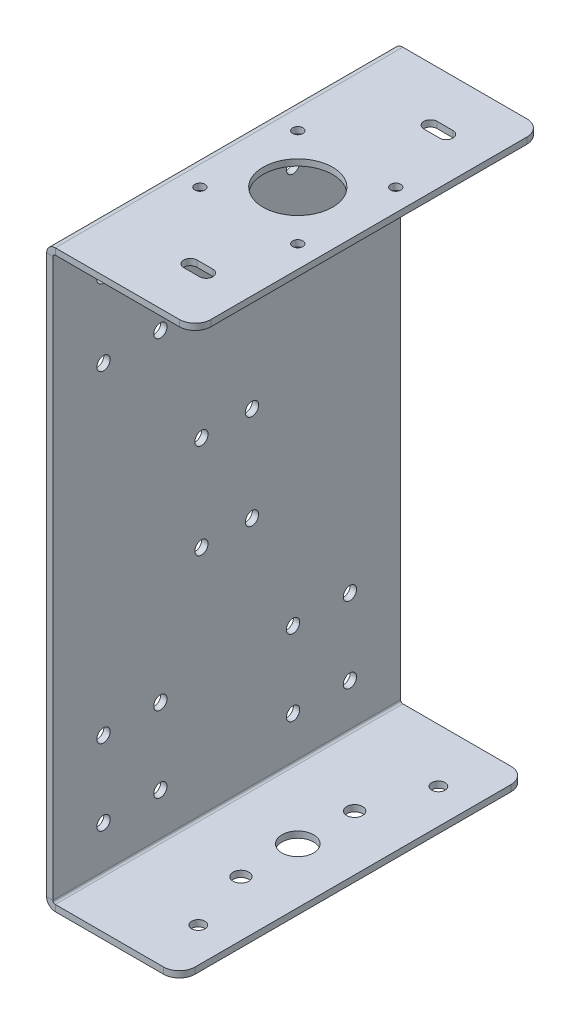
from build123d import *

# Parameters (mm, degrees)
SKETCH1_W                    = 2
SKETCH1_H                    = 182
BASE_FLANGE1_DEPTH           = 55
EDGE_FLANGE1_STRIP_W         = 9.4732
EDGE_FLANGE1_STRIP_H         = 2
EDGE_FLANGE1_STRIP_CUT_DEPTH = 110
EDGE_FLANGE1_DEPTH           = 110
EDGE_FLANGE2_STRIP_W         = 9.4732
EDGE_FLANGE2_STRIP_H         = 2
EDGE_FLANGE2_STRIP_CUT_DEPTH = 110
EDGE_FLANGE2_DEPTH           = 110
FILLET1_R                    = 5
CUT_EXTRUDE1_REACH           = 118.254
SKETCH13_R                   = 2.1
CUT_EXTRUDE2_REACH           = 193.576
SKETCH14_R                   = 11
SKETCH14_R_2                 = 1.6
CUT_EXTRUDE3_REACH           = 193.576
SKETCH15_R                   = 2.5
SKETCH15_R_2                 = 5
CUT_EXTRUDE4_REACH           = 118.254
SKETCH16_R                   = 2.1
CUT_EXTRUDE5_REACH           = 193.576
CUT_EXTRUDE6_REACH           = 193.576
SKETCH18_R                   = 2.1


# Sheet-metal steps are written as plain solids
with BuildPart() as part:
    # Sketch1 → Base-Flange1 (new, symmetric)
    with BuildSketch(Plane.XY):
        with Locations((-22.5, 0)):
            Rectangle(SKETCH1_W, SKETCH1_H)
    extrude(amount=BASE_FLANGE1_DEPTH, both=True)

    # Edge-Flange1 strip (across the edge) → Edge-Flange1 strip cut (cut)
    with BuildSketch(Plane(origin=(-21.5, 91, -55), x_dir=(0, -1, 0), z_dir=(0, 0, 1))):
        with Locations((-2, -1)):
            Rectangle(EDGE_FLANGE1_STRIP_W, EDGE_FLANGE1_STRIP_H)
    extrude(amount=EDGE_FLANGE1_STRIP_CUT_DEPTH, mode=Mode.SUBTRACT)

    # Edge-Flange1 section (across the edge) → Edge-Flange1 (add)
    with BuildSketch(Plane(origin=(-21.5, 91, -55), x_dir=(0, -1, 0), z_dir=(0, 0, 1))):
        with BuildLine():
            Line((0, 0.7366), (0, 45))
            Line((0, 45), (2, 45))
            Line((2, 45), (2, 0.7366))
            ThreePointArc((2, 0.7366), (2.215745145, 0.215745145), (2.7366, 0))
            Line((2.7366, 0), (2.7366, -2))
            ThreePointArc((2.7366, -2), (0.801531583, -1.198468417), (0, 0.7366))
        make_face()
    extrude(amount=EDGE_FLANGE1_DEPTH)

    # Edge-Flange2 strip (across the edge) → Edge-Flange2 strip cut (cut)
    with BuildSketch(Plane(origin=(-21.5, -91, 55), x_dir=(0, 1, 0), z_dir=(0, 0, -1))):
        with Locations((-2, -1)):
            Rectangle(EDGE_FLANGE2_STRIP_W, EDGE_FLANGE2_STRIP_H)
    extrude(amount=EDGE_FLANGE2_STRIP_CUT_DEPTH, mode=Mode.SUBTRACT)

    # Edge-Flange2 section (across the edge) → Edge-Flange2 (add)
    with BuildSketch(Plane(origin=(-21.5, -91, 55), x_dir=(0, 1, 0), z_dir=(0, 0, -1))):
        with BuildLine():
            Line((0, 0.7366), (0, 40))
            Line((0, 40), (2, 40))
            Line((2, 40), (2, 0.7366))
            ThreePointArc((2, 0.7366), (2.215745145, 0.215745145), (2.7366, 0))
            Line((2.7366, 0), (2.7366, -2))
            ThreePointArc((2.7366, -2), (0.801531583, -1.198468417), (0, 0.7366))
        make_face()
    extrude(amount=EDGE_FLANGE2_DEPTH)

    # Fillet1
    fillet1_edges = [part.edges().sort_by_distance(p)[0] for p in [
        (23.5, 90, -55),
        (23.5, 90, 55),
        (18.5, -90, -55),
        (18.5, -90, 55),
    ]]
    fillet(fillet1_edges, radius=FILLET1_R)

    # Sketch13 → Cut-Extrude1 (cut, up to next)
    with BuildSketch(Plane.ZY.offset(23.5), mode=Mode.PRIVATE) as cut_extrude1_sk1:
        with Locations(Location((-39, 75, 0), (0, 0, 270))):
            Circle(SKETCH13_R)
    cut_extrude1_tool1 = extrude(cut_extrude1_sk1.sketch, amount=-CUT_EXTRUDE1_REACH, mode=Mode.PRIVATE) & part.part
    # Sketch13 → Cut-Extrude1 (cut, up to next)
    with BuildSketch(Plane.ZY.offset(23.5), mode=Mode.PRIVATE) as cut_extrude1_sk2:
        with Locations(Location((-39, 51, 0), (0, 0, 270))):
            Circle(SKETCH13_R)
    cut_extrude1_tool2 = extrude(cut_extrude1_sk2.sketch, amount=-CUT_EXTRUDE1_REACH, mode=Mode.PRIVATE) & part.part
    # Sketch13 → Cut-Extrude1 (cut, up to next)
    with BuildSketch(Plane.ZY.offset(23.5), mode=Mode.PRIVATE) as cut_extrude1_sk3:
        with Locations(Location((-21, 75, 0), (0, 0, 270))):
            Circle(SKETCH13_R)
    cut_extrude1_tool3 = extrude(cut_extrude1_sk3.sketch, amount=-CUT_EXTRUDE1_REACH, mode=Mode.PRIVATE) & part.part
    # Sketch13 → Cut-Extrude1 (cut, up to next)
    with BuildSketch(Plane.ZY.offset(23.5), mode=Mode.PRIVATE) as cut_extrude1_sk4:
        with Locations(Location((-21, 51, 0), (0, 0, 270))):
            Circle(SKETCH13_R)
    cut_extrude1_tool4 = extrude(cut_extrude1_sk4.sketch, amount=-CUT_EXTRUDE1_REACH, mode=Mode.PRIVATE) & part.part
    # Sketch13 → Cut-Extrude1 (cut, up to next)
    with BuildSketch(Plane.ZY.offset(23.5), mode=Mode.PRIVATE) as cut_extrude1_sk5:
        with Locations(Location((21, 75, 0), (0, 0, 270))):
            Circle(SKETCH13_R)
    cut_extrude1_tool5 = extrude(cut_extrude1_sk5.sketch, amount=-CUT_EXTRUDE1_REACH, mode=Mode.PRIVATE) & part.part
    # Sketch13 → Cut-Extrude1 (cut, up to next)
    with BuildSketch(Plane.ZY.offset(23.5), mode=Mode.PRIVATE) as cut_extrude1_sk6:
        with Locations(Location((21, 51, 0), (0, 0, 270))):
            Circle(SKETCH13_R)
    cut_extrude1_tool6 = extrude(cut_extrude1_sk6.sketch, amount=-CUT_EXTRUDE1_REACH, mode=Mode.PRIVATE) & part.part
    # Sketch13 → Cut-Extrude1 (cut, up to next)
    with BuildSketch(Plane.ZY.offset(23.5), mode=Mode.PRIVATE) as cut_extrude1_sk7:
        with Locations(Location((39, 75, 0), (0, 0, 270))):
            Circle(SKETCH13_R)
    cut_extrude1_tool7 = extrude(cut_extrude1_sk7.sketch, amount=-CUT_EXTRUDE1_REACH, mode=Mode.PRIVATE) & part.part
    # Sketch13 → Cut-Extrude1 (cut, up to next)
    with BuildSketch(Plane.ZY.offset(23.5), mode=Mode.PRIVATE) as cut_extrude1_sk8:
        with Locations(Location((39, 51, 0), (0, 0, 270))):
            Circle(SKETCH13_R)
    cut_extrude1_tool8 = extrude(cut_extrude1_sk8.sketch, amount=-CUT_EXTRUDE1_REACH, mode=Mode.PRIVATE) & part.part
    cut_extrude1_1 = cut_extrude1_tool1.solids().sort_by_distance((-23.5, 75, -39))[0]
    add(cut_extrude1_1, mode=Mode.SUBTRACT)
    cut_extrude1_2 = cut_extrude1_tool2.solids().sort_by_distance((-23.5, 51, -39))[0]
    add(cut_extrude1_2, mode=Mode.SUBTRACT)
    cut_extrude1_3 = cut_extrude1_tool3.solids().sort_by_distance((-23.5, 75, -21))[0]
    add(cut_extrude1_3, mode=Mode.SUBTRACT)
    cut_extrude1_4 = cut_extrude1_tool4.solids().sort_by_distance((-23.5, 51, -21))[0]
    add(cut_extrude1_4, mode=Mode.SUBTRACT)
    cut_extrude1_5 = cut_extrude1_tool5.solids().sort_by_distance((-23.5, 75, 21))[0]
    add(cut_extrude1_5, mode=Mode.SUBTRACT)
    cut_extrude1_6 = cut_extrude1_tool6.solids().sort_by_distance((-23.5, 51, 21))[0]
    add(cut_extrude1_6, mode=Mode.SUBTRACT)
    cut_extrude1_7 = cut_extrude1_tool7.solids().sort_by_distance((-23.5, 75, 39))[0]
    add(cut_extrude1_7, mode=Mode.SUBTRACT)
    cut_extrude1_8 = cut_extrude1_tool8.solids().sort_by_distance((-23.5, 51, 39))[0]
    add(cut_extrude1_8, mode=Mode.SUBTRACT)
    cut_extrude1 = cut_extrude1_1 + cut_extrude1_2 + cut_extrude1_3 + cut_extrude1_4 + cut_extrude1_5 + cut_extrude1_6 + cut_extrude1_7 + cut_extrude1_8  # Cut-Extrude1 as one shape, for the pattern or mirror that repeats it

    # Mirror1: Cut-Extrude1 across plane
    add(cut_extrude1.mirror(Plane.ZX), mode=Mode.SUBTRACT)

    # Sketch14 → Cut-Extrude2 (cut, up to next)
    with BuildSketch(Plane(origin=(0, 91, 0), x_dir=(1, 0, 0), z_dir=(0, 1, 0)), mode=Mode.PRIVATE) as cut_extrude2_sk1:
        with Locations(Location((1, 0, 0), (0, 0, 180))):
            Circle(SKETCH14_R)
    cut_extrude2_tool1 = extrude(cut_extrude2_sk1.sketch, amount=-CUT_EXTRUDE2_REACH, mode=Mode.PRIVATE) & part.part
    # Sketch14 → Cut-Extrude2 (cut, up to next)
    with BuildSketch(Plane(origin=(0, 91, 0), x_dir=(1, 0, 0), z_dir=(0, 1, 0)), mode=Mode.PRIVATE) as cut_extrude2_sk2:
        with Locations(Location((-14.5, 15.5, 0), (0, 0, 180))):
            Circle(SKETCH14_R_2)
    cut_extrude2_tool2 = extrude(cut_extrude2_sk2.sketch, amount=-CUT_EXTRUDE2_REACH, mode=Mode.PRIVATE) & part.part
    # Sketch14 → Cut-Extrude2 (cut, up to next)
    with BuildSketch(Plane(origin=(0, 91, 0), x_dir=(1, 0, 0), z_dir=(0, 1, 0)), mode=Mode.PRIVATE) as cut_extrude2_sk3:
        with Locations(Location((16.5, 15.5, 0), (0, 0, 180))):
            Circle(SKETCH14_R_2)
    cut_extrude2_tool3 = extrude(cut_extrude2_sk3.sketch, amount=-CUT_EXTRUDE2_REACH, mode=Mode.PRIVATE) & part.part
    # Sketch14 → Cut-Extrude2 (cut, up to next)
    with BuildSketch(Plane(origin=(0, 91, 0), x_dir=(1, 0, 0), z_dir=(0, 1, 0)), mode=Mode.PRIVATE) as cut_extrude2_sk4:
        with Locations(Location((-14.5, -15.5, 0), (0, 0, 180))):
            Circle(SKETCH14_R_2)
    cut_extrude2_tool4 = extrude(cut_extrude2_sk4.sketch, amount=-CUT_EXTRUDE2_REACH, mode=Mode.PRIVATE) & part.part
    # Sketch14 → Cut-Extrude2 (cut, up to next)
    with BuildSketch(Plane(origin=(0, 91, 0), x_dir=(1, 0, 0), z_dir=(0, 1, 0)), mode=Mode.PRIVATE) as cut_extrude2_sk5:
        with Locations(Location((16.5, -15.5, 0), (0, 0, 180))):
            Circle(SKETCH14_R_2)
    cut_extrude2_tool5 = extrude(cut_extrude2_sk5.sketch, amount=-CUT_EXTRUDE2_REACH, mode=Mode.PRIVATE) & part.part
    add(cut_extrude2_tool1.solids().sort_by_distance((1, 91, 0))[0], mode=Mode.SUBTRACT)
    add(cut_extrude2_tool2.solids().sort_by_distance((-14.5, 91, -15.5))[0], mode=Mode.SUBTRACT)
    add(cut_extrude2_tool3.solids().sort_by_distance((16.5, 91, -15.5))[0], mode=Mode.SUBTRACT)
    add(cut_extrude2_tool4.solids().sort_by_distance((-14.5, 91, 15.5))[0], mode=Mode.SUBTRACT)
    add(cut_extrude2_tool5.solids().sort_by_distance((16.5, 91, 15.5))[0], mode=Mode.SUBTRACT)

    # Sketch15 → Cut-Extrude3 (cut, up to next)
    with BuildSketch(Plane.XZ.offset(91), mode=Mode.PRIVATE) as cut_extrude3_sk1:
        with Locations((1, 18)):
            Circle(SKETCH15_R)
    cut_extrude3_tool1 = extrude(cut_extrude3_sk1.sketch, amount=-CUT_EXTRUDE3_REACH, mode=Mode.PRIVATE) & part.part
    # Sketch15 → Cut-Extrude3 (cut, up to next)
    with BuildSketch(Plane.XZ.offset(91), mode=Mode.PRIVATE) as cut_extrude3_sk2:
        with Locations((1, -18)):
            Circle(SKETCH15_R)
    cut_extrude3_tool2 = extrude(cut_extrude3_sk2.sketch, amount=-CUT_EXTRUDE3_REACH, mode=Mode.PRIVATE) & part.part
    # Sketch15 → Cut-Extrude3 (cut, up to next)
    with BuildSketch(Plane.XZ.offset(91), mode=Mode.PRIVATE) as cut_extrude3_sk3:
        with Locations((1, 0)):
            Circle(SKETCH15_R_2)
    cut_extrude3_tool3 = extrude(cut_extrude3_sk3.sketch, amount=-CUT_EXTRUDE3_REACH, mode=Mode.PRIVATE) & part.part
    add(cut_extrude3_tool1.solids().sort_by_distance((1, -91, 18))[0], mode=Mode.SUBTRACT)
    add(cut_extrude3_tool2.solids().sort_by_distance((1, -91, -18))[0], mode=Mode.SUBTRACT)
    add(cut_extrude3_tool3.solids().sort_by_distance((1, -91, 0))[0], mode=Mode.SUBTRACT)

    # Sketch16 → Cut-Extrude4 (cut, up to next)
    with BuildSketch(Plane.ZY.offset(23.5), mode=Mode.PRIVATE) as cut_extrude4_sk1:
        with Locations(Location((-8, 15, 0), (0, 0, 270))):
            Circle(SKETCH16_R)
    cut_extrude4_tool1 = extrude(cut_extrude4_sk1.sketch, amount=-CUT_EXTRUDE4_REACH, mode=Mode.PRIVATE) & part.part
    # Sketch16 → Cut-Extrude4 (cut, up to next)
    with BuildSketch(Plane.ZY.offset(23.5), mode=Mode.PRIVATE) as cut_extrude4_sk2:
        with Locations(Location((-8, -15, 0), (0, 0, 270))):
            Circle(SKETCH16_R)
    cut_extrude4_tool2 = extrude(cut_extrude4_sk2.sketch, amount=-CUT_EXTRUDE4_REACH, mode=Mode.PRIVATE) & part.part
    # Sketch16 → Cut-Extrude4 (cut, up to next)
    with BuildSketch(Plane.ZY.offset(23.5), mode=Mode.PRIVATE) as cut_extrude4_sk3:
        with Locations(Location((8, 15, 0), (0, 0, 270))):
            Circle(SKETCH16_R)
    cut_extrude4_tool3 = extrude(cut_extrude4_sk3.sketch, amount=-CUT_EXTRUDE4_REACH, mode=Mode.PRIVATE) & part.part
    # Sketch16 → Cut-Extrude4 (cut, up to next)
    with BuildSketch(Plane.ZY.offset(23.5), mode=Mode.PRIVATE) as cut_extrude4_sk4:
        with Locations(Location((8, -15, 0), (0, 0, 270))):
            Circle(SKETCH16_R)
    cut_extrude4_tool4 = extrude(cut_extrude4_sk4.sketch, amount=-CUT_EXTRUDE4_REACH, mode=Mode.PRIVATE) & part.part
    add(cut_extrude4_tool1.solids().sort_by_distance((-23.5, 15, -8))[0], mode=Mode.SUBTRACT)
    add(cut_extrude4_tool2.solids().sort_by_distance((-23.5, -15, -8))[0], mode=Mode.SUBTRACT)
    add(cut_extrude4_tool3.solids().sort_by_distance((-23.5, 15, 8))[0], mode=Mode.SUBTRACT)
    add(cut_extrude4_tool4.solids().sort_by_distance((-23.5, -15, 8))[0], mode=Mode.SUBTRACT)

    # Sketch17 → Cut-Extrude5 (cut, up to next)
    with BuildSketch(Plane(origin=(0, 91, 0), x_dir=(1, 0, 0), z_dir=(0, 1, 0)), mode=Mode.PRIVATE) as cut_extrude5_sk1:
        with BuildLine():
            Line((5, 40.1), (10, 40.1))
            ThreePointArc((10, 40.1), (12.1, 38), (10, 35.9))
            Line((10, 35.9), (5, 35.9))
            ThreePointArc((5, 35.9), (2.9, 38), (5, 40.1))
        make_face()
    cut_extrude5_tool1 = extrude(cut_extrude5_sk1.sketch, amount=-CUT_EXTRUDE5_REACH, mode=Mode.PRIVATE) & part.part
    # Sketch17 → Cut-Extrude5 (cut, up to next)
    with BuildSketch(Plane(origin=(0, 91, 0), x_dir=(1, 0, 0), z_dir=(0, 1, 0)), mode=Mode.PRIVATE) as cut_extrude5_sk2:
        with BuildLine():
            Line((5, -35.9), (10, -35.9))
            ThreePointArc((10, -35.9), (12.1, -38), (10, -40.1))
            Line((10, -40.1), (5, -40.1))
            ThreePointArc((5, -40.1), (2.9, -38), (5, -35.9))
        make_face()
    cut_extrude5_tool2 = extrude(cut_extrude5_sk2.sketch, amount=-CUT_EXTRUDE5_REACH, mode=Mode.PRIVATE) & part.part
    add(cut_extrude5_tool1.solids().sort_by_distance((7.5, 91, -38))[0], mode=Mode.SUBTRACT)
    add(cut_extrude5_tool2.solids().sort_by_distance((7.5, 91, 38))[0], mode=Mode.SUBTRACT)

    # Sketch18 → Cut-Extrude6 (cut, up to next)
    with BuildSketch(Plane.XZ.offset(91), mode=Mode.PRIVATE) as cut_extrude6_sk1:
        with Locations((7.5, 38)):
            Circle(SKETCH18_R)
    cut_extrude6_tool1 = extrude(cut_extrude6_sk1.sketch, amount=-CUT_EXTRUDE6_REACH, mode=Mode.PRIVATE) & part.part
    # Sketch18 → Cut-Extrude6 (cut, up to next)
    with BuildSketch(Plane.XZ.offset(91), mode=Mode.PRIVATE) as cut_extrude6_sk2:
        with Locations((7.5, -38)):
            Circle(SKETCH18_R)
    cut_extrude6_tool2 = extrude(cut_extrude6_sk2.sketch, amount=-CUT_EXTRUDE6_REACH, mode=Mode.PRIVATE) & part.part
    add(cut_extrude6_tool1.solids().sort_by_distance((7.5, -91, 38))[0], mode=Mode.SUBTRACT)
    add(cut_extrude6_tool2.solids().sort_by_distance((7.5, -91, -38))[0], mode=Mode.SUBTRACT)


solid = part.part
